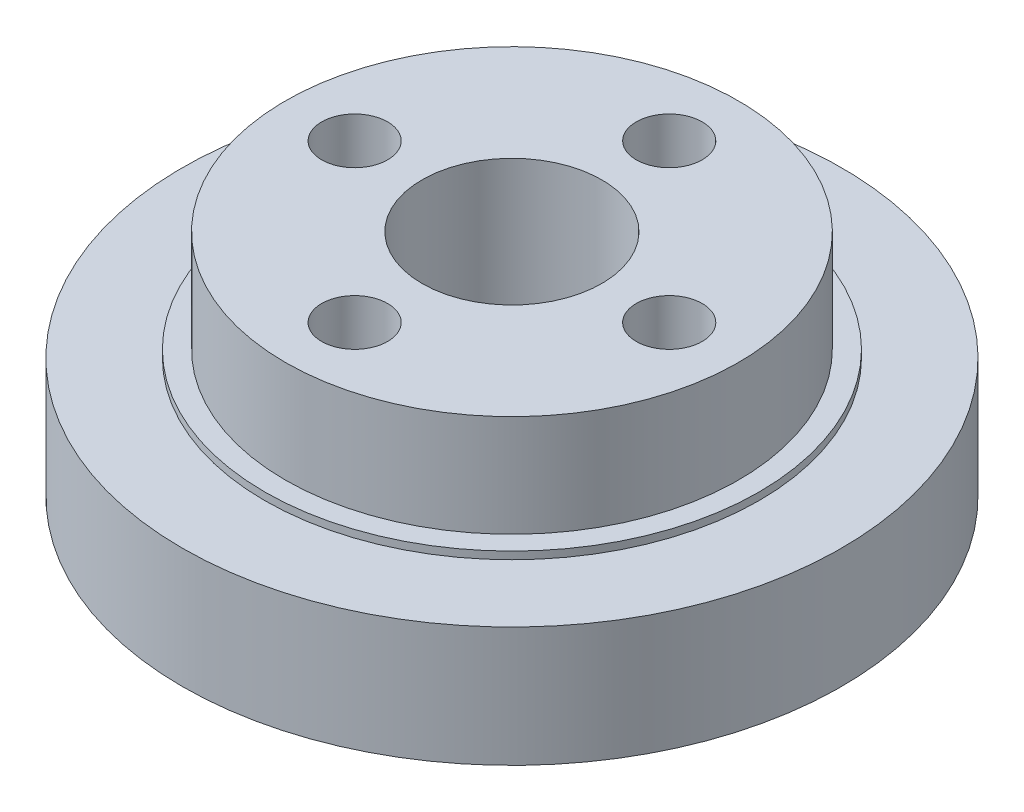
from build123d import *

# Parameters (mm, degrees)
SKETCH1_R           = 22
BOSS_EXTRUDE1_DEPTH = 8
SKETCH2_R           = 16.5
BOSS_EXTRUDE2_DEPTH = 0.5
SKETCH3_R           = 15.125
BOSS_EXTRUDE3_DEPTH = 6.8
SKETCH4_R           = 6
CUT_EXTRUDE1_DEPTH  = 35.671169579
SKETCH5_R           = 1.6
CUT_EXTRUDE2_DEPTH  = 7
CIRPATTERN1_COUNT   = 6
SKETCH6_R           = 2.2
CUT_EXTRUDE3_DEPTH  = 5.5
CIRPATTERN2_COUNT   = 4


with BuildPart() as part:
    # Sketch1 → Boss-Extrude1 (new body)
    with BuildSketch(Plane(origin=(0, 0, 0), x_dir=(1, 0, 0), z_dir=(0, 1, 0))):
        Circle(SKETCH1_R)
    extrude(amount=BOSS_EXTRUDE1_DEPTH)

    # Sketch2 → Boss-Extrude2 (add)
    with BuildSketch(Plane(origin=(0, 8, 0), x_dir=(1, 0, 0), z_dir=(0, 1, 0))):
        Circle(SKETCH2_R)
    extrude(amount=BOSS_EXTRUDE2_DEPTH)

    # Sketch3 → Boss-Extrude3 (add)
    with BuildSketch(Plane(origin=(0, 8.5, 0), x_dir=(1, 0, 0), z_dir=(0, 1, 0))):
        Circle(SKETCH3_R)
    extrude(amount=BOSS_EXTRUDE3_DEPTH)

    # Sketch4 → Cut-Extrude1 (cut, through all)
    with BuildSketch(Plane(origin=(0, 15.3, 0), x_dir=(1, 0, 0), z_dir=(0, 1, 0))):
        Circle(SKETCH4_R)
    extrude(amount=-CUT_EXTRUDE1_DEPTH, mode=Mode.SUBTRACT)

    # Sketch5 → Cut-Extrude2 (cut)
    with BuildSketch(Plane(origin=(0, 0, 0), x_dir=(1, 0, 0), z_dir=(0, 1, 0))):
        with Locations((18.272234301, 2.894037603)):
            Circle(SKETCH5_R)
    cut_extrude2 = extrude(amount=CUT_EXTRUDE2_DEPTH, mode=Mode.SUBTRACT)

    # CirPattern1: Cut-Extrude2 ×6 about axis
    cirpattern1_axis = Axis((0, 8, 0), (0, -1, 0))
    for i in range(1, CIRPATTERN1_COUNT):
        add(cut_extrude2.rotate(cirpattern1_axis, i * 360 / CIRPATTERN1_COUNT), mode=Mode.SUBTRACT)

    # Sketch6 → Cut-Extrude3 (cut)
    with BuildSketch(Plane(origin=(0, 15.3, 0), x_dir=(1, 0, 0), z_dir=(0, 1, 0))):
        with Locations((10.5, 0)):
            Circle(SKETCH6_R)
    cut_extrude3 = extrude(amount=-CUT_EXTRUDE3_DEPTH, mode=Mode.SUBTRACT)

    # CirPattern2: Cut-Extrude3 ×4 about axis
    cirpattern2_axis = Axis((0, 8, 0), (0, -1, 0))
    for i in range(1, CIRPATTERN2_COUNT):
        add(cut_extrude3.rotate(cirpattern2_axis, i * 360 / CIRPATTERN2_COUNT), mode=Mode.SUBTRACT)


solid = part.part
